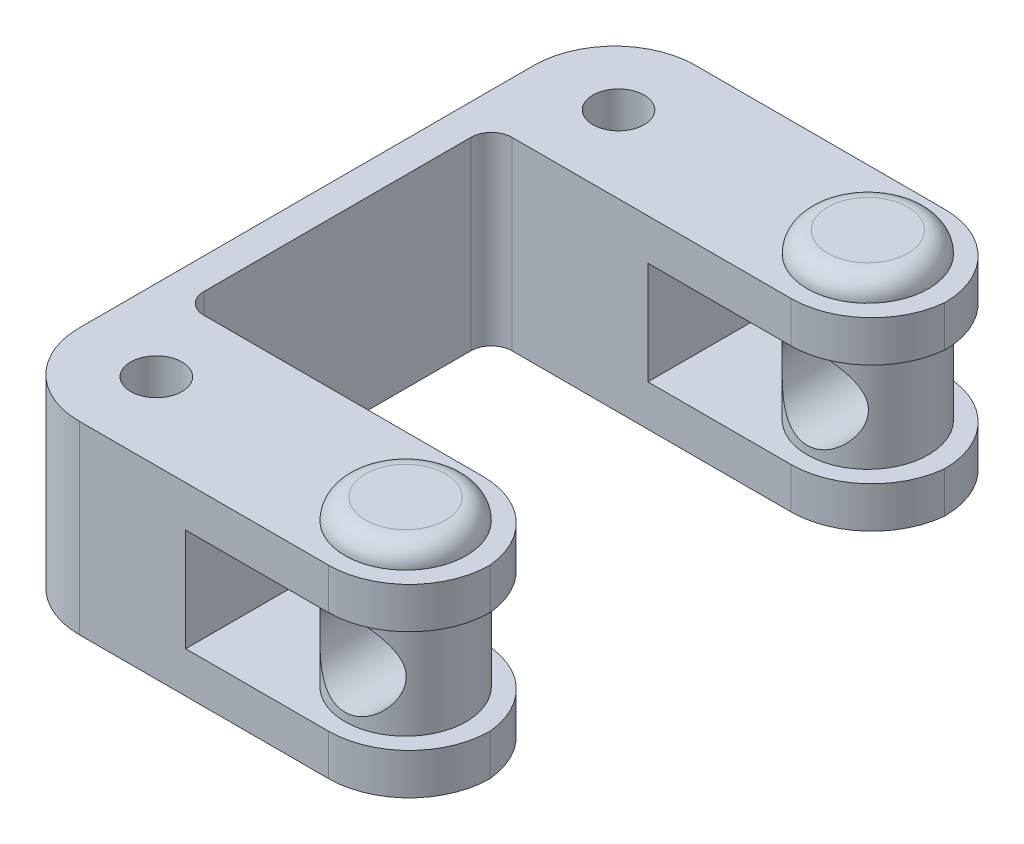
from build123d import *

# Parameters (mm, degrees)
BOSS_EXTRUDE4_DEPTH = 76.2
FILLET1_R           = 10
SKETCH8_W           = 46.99
SKETCH8_H           = 38.1
CUT_EXTRUDE2_DEPTH  = 25.4
FILLET2_R           = 10
SKETCH9_R           = 7.493
BOSS_EXTRUDE5_DEPTH = 2.54
FILLET4_R           = 2.54
BOSS_EXTRUDE6_REACH = 94.231
SKETCH10_R          = 7.493
SKETCH11_R          = 5.334
CUT_EXTRUDE3_DEPTH  = 76.2
FILLET5_R           = 2.54
CUT_EXTRUDE5_REACH  = 94.824
SKETCH14_R          = 3.175


# Some blends are built 0.0001 mm under size
with BuildPart() as part:
    # Sketch7 → Boss-Extrude4 (new body)
    with BuildSketch(Plane.XY):
        Polygon((-47.824509335, -17.216733289), (2.975490665, -17.216733289), (2.975490665, -22.296733289), (-24.669160498, -22.296733289), (-24.669160498, -34.996733289), (2.975490665, -34.996733289), (2.975490665, -40.076733289), (-47.824509335, -40.076733289), (-47.824509335, -34.996733289), (-47.824509335, -22.296733289), align=None)
    extrude(amount=BOSS_EXTRUDE4_DEPTH)

    # Fillet1
    fillet1_edges = [part.edges().sort_by_distance(p)[0] for p in [
        (2.975490665, -19.756733289, 0),
        (2.975490665, -37.536733289, 0),
        (-47.824509335, -28.646733289, 0),
        (2.975490665, -37.536733289, 76.2),
        (2.975490665, -19.756733289, 76.2),
        (-47.824509335, -28.646733289, 76.2),
    ]]
    fillet(fillet1_edges, radius=FILLET1_R)

    # Sketch8 → Cut-Extrude2 (cut)
    with BuildSketch(Plane(origin=(0, -17.216733289, 0), x_dir=(1, 0, 0), z_dir=(0, 1, 0))):
        with Locations((-20.519509335, -38.1)):
            Rectangle(SKETCH8_W, SKETCH8_H)
    extrude(amount=-CUT_EXTRUDE2_DEPTH, mode=Mode.SUBTRACT)

    # Fillet2
    # the kernel refuses this fillet: 10 mm, written as the material it takes off along each edge
    with BuildSketch(Plane(origin=(2.975490665, -10.109801477, 57.15), x_dir=(-1, 0, 0), z_dir=(0, -1, 0)), Plane(origin=(2.975490665, 7.670198523, 57.15), x_dir=(-1, 0, 0), z_dir=(0, -1, 0))) as fillet2_piece_1:
        with BuildLine():
            CenterArc((9.954772725, -10), FILLET2_R, 90, 84.548680188)
            Line((0, -9.05), (-0.199095454, -9.031))
            ThreePointArc((-0.199095454, -9.031), (-0.2, -4.525), (-0.2, 0))
            Line((-0.2, 0), (0, 0.2))
            Line((0, 0.2), (9.954772725, 0.2))
            Line((9.954772725, 0.2), (9.954772725, 0))
        make_face()
    extrude(amount=54.853863623, mode=Mode.SUBTRACT)
    with BuildSketch(Plane(origin=(2.975490665, -10.109801477, 19.05), x_dir=(-1, 0, 0), z_dir=(0, -1, 0))) as fillet2_piece_2:
        with BuildLine():
            CenterArc((9.954772725, 10), FILLET2_R, 185.451319812, 84.548680188)
            Line((0, 9.05), (-0.199095454, 9.031))
            ThreePointArc((-0.199095454, 9.031), (-0.2, 4.525), (-0.2, 0))
            Line((-0.2, 0), (0, -0.2))
            Line((0, -0.2), (9.954772725, -0.2))
            Line((9.954772725, -0.2), (9.954772725, 0))
        make_face()
    extrude(amount=54.853863623, mode=Mode.SUBTRACT)
    with BuildSketch(Plane(origin=(2.975490665, 7.670198523, 19.05), x_dir=(0, 0, -1), z_dir=(0, -1, 0))) as fillet2_piece_3:
        with BuildLine():
            CenterArc((10, -9.954772725), FILLET2_R, 95.451319812, 84.548680188)
            Line((0, -9.954772725), (-0.2, -9.954772725))
            Line((-0.2, -9.954772725), (-0.2, 0))
            Line((-0.2, 0), (0, 0.2))
            ThreePointArc((0, 0.2), (4.525, 0.2), (9.031, 0.199095454))
            Line((9.031, 0.199095454), (9.05, 0))
        make_face()
    extrude(amount=54.853863623, mode=Mode.SUBTRACT)

    # Sketch9 → Boss-Extrude5 (add)
    with BuildSketch(Plane(origin=(0, -17.216733289, 0), x_dir=(1, 0, 0), z_dir=(0, 1, 0))):
        with Locations(Location((-7.001895697, -66.675, 0), (0, 0, 270))):
            Circle(SKETCH9_R)
        with Locations(Location((-7.001895697, -9.525, 0), (0, 0, 270))):
            Circle(SKETCH9_R)
    extrude(amount=BOSS_EXTRUDE5_DEPTH)

    # Fillet4
    fillet4_edges = [part.edges().sort_by_distance(p)[0] for p in [
        (-7.001895697, -14.676733289, 59.182),
        (-7.001895697, -14.676733289, 2.032),
    ]]
    fillet(fillet4_edges, radius=FILLET4_R - 0.0001)  # a hair under: the kernel refuses the full size

    # Sketch10 → Boss-Extrude6 (add, up to next)
    with BuildSketch(Plane(origin=(0, -34.996733289, 0), x_dir=(1, 0, 0), z_dir=(0, 1, 0)), mode=Mode.PRIVATE) as boss_extrude6_sk1:
        with Locations(Location((-7.001895697, -66.675, 0), (0, 0, 90))):
            Circle(SKETCH10_R)
    boss_extrude6_tool1 = extrude(boss_extrude6_sk1.sketch, amount=BOSS_EXTRUDE6_REACH, mode=Mode.PRIVATE) - part.part
    # Sketch10 → Boss-Extrude6 (add, up to next)
    with BuildSketch(Plane(origin=(0, -34.996733289, 0), x_dir=(1, 0, 0), z_dir=(0, 1, 0)), mode=Mode.PRIVATE) as boss_extrude6_sk2:
        with Locations(Location((-7.001895697, -9.525, 0), (0, 0, 90))):
            Circle(SKETCH10_R)
    boss_extrude6_tool2 = extrude(boss_extrude6_sk2.sketch, amount=BOSS_EXTRUDE6_REACH, mode=Mode.PRIVATE) - part.part
    add(boss_extrude6_tool1.solids().sort_by_distance((-7.001896, -34.996733, 66.675))[0])
    add(boss_extrude6_tool2.solids().sort_by_distance((-7.001896, -34.996733, 9.525))[0])

    # Sketch11 → Cut-Extrude3 (cut)
    with BuildSketch(Plane.XY.offset(76.2)):
        with Locations(Location((-7.001895697, -28.646733289, 0), (0, 0, 90.00000003))):
            Circle(SKETCH11_R)
    extrude(amount=-CUT_EXTRUDE3_DEPTH, mode=Mode.SUBTRACT)

    # Fillet5
    fillet5_edges = [part.edges().sort_by_distance(p)[0] for p in [
        (-44.014509335, -28.646733289, 57.15),
        (-44.014509335, -28.646733289, 19.05),
    ]]
    fillet(fillet5_edges, radius=FILLET5_R)

    # Sketch14 → Cut-Extrude5 (cut, up to next)
    with BuildSketch(Plane(origin=(0, -17.216733289, 0), x_dir=(1, 0, 0), z_dir=(0, 1, 0)), mode=Mode.PRIVATE) as cut_extrude5_sk1:
        with Locations(Location((-37.824509335, -9.525, 0), (0, 0, 270))):
            Circle(SKETCH14_R)
    cut_extrude5_tool1 = extrude(cut_extrude5_sk1.sketch, amount=-CUT_EXTRUDE5_REACH, mode=Mode.PRIVATE) & part.part
    # Sketch14 → Cut-Extrude5 (cut, up to next)
    with BuildSketch(Plane(origin=(0, -17.216733289, 0), x_dir=(1, 0, 0), z_dir=(0, 1, 0)), mode=Mode.PRIVATE) as cut_extrude5_sk2:
        with Locations(Location((-37.824509335, -66.675, 0), (0, 0, 270))):
            Circle(SKETCH14_R)
    cut_extrude5_tool2 = extrude(cut_extrude5_sk2.sketch, amount=-CUT_EXTRUDE5_REACH, mode=Mode.PRIVATE) & part.part
    add(cut_extrude5_tool1.solids().sort_by_distance((-37.824509, -17.216733, 9.525))[0], mode=Mode.SUBTRACT)
    add(cut_extrude5_tool2.solids().sort_by_distance((-37.824509, -17.216733, 66.675))[0], mode=Mode.SUBTRACT)


solid = part.part
